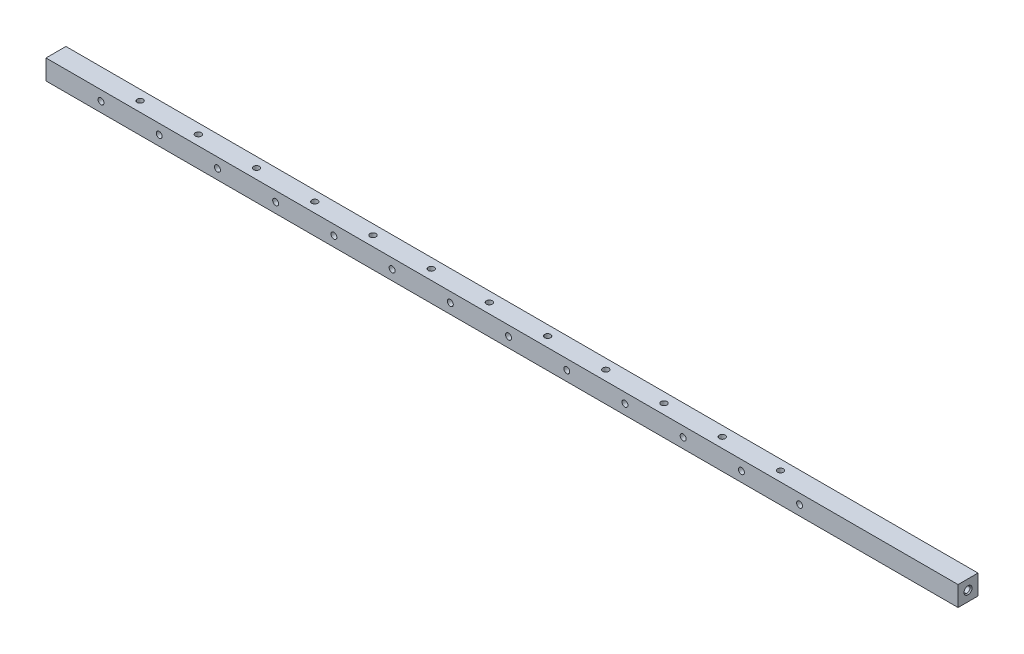
from build123d import *

# Parameters (mm, degrees)
SKETCH1_W                        = 12.7
SKETCH1_H                        = 12.7
BOSS_EXTRUDE1_DEPTH              = 581
F_10_24_TAPPED_HOLE1_D           = 3.7973
F_10_24_TAPPED_HOLE2_D           = 3.7973
M6X1_0_TAPPED_HOLE2_D            = 5
M6X1_0_TAPPED_HOLE2_DEPTH        = 20.32
M6X1_0_TAPPED_HOLE2_CSINK_D      = 6.05
M6X1_0_TAPPED_HOLE2_CSINK_ANGLE  = 90
M6X1_0_TAPPED_HOLE2_TIP          = 1.502151548
F_10_24_TAPPED_HOLE3_D           = 3.7973
F_10_24_TAPPED_HOLE3_DEPTH       = 20.574
F_10_24_TAPPED_HOLE3_CSINK_D     = 5.0673
F_10_24_TAPPED_HOLE3_CSINK_ANGLE = 90
F_10_24_TAPPED_HOLE3_TIP         = 1.140824014
LPATTERN1_COUNT                  = 13
LPATTERN1_PITCH                  = 37.084
LPATTERN2_COUNT                  = 12
LPATTERN2_PITCH                  = 37.084


with BuildPart() as part:
    # Sketch1 → Boss-Extrude1 (new body)
    with BuildSketch(Plane(origin=(0, 0, 0), x_dir=(0, 0, -1), z_dir=(1, 0, 0))):
        Rectangle(SKETCH1_W, SKETCH1_H)
    extrude(amount=BOSS_EXTRUDE1_DEPTH)

    # #10-24 Tapped Hole1 (through all)
    with Locations(Plane.XY.offset(6.35)):
        with Locations((35.052, 0)):
            f_10_24_tapped_hole1 = Hole(F_10_24_TAPPED_HOLE1_D / 2)

    # #10-24 Tapped Hole2 (through all)
    with Locations(Plane(origin=(0, 6.35, 0), x_dir=(1, 0, 0), z_dir=(0, 1, 0))):
        with Locations((53.594, 0)):
            f_10_24_tapped_hole2 = Hole(F_10_24_TAPPED_HOLE2_D / 2)

    # M6x1.0 Tapped Hole2
    with Locations(Plane.ZY):
        with Locations((0, 0)):
            CounterSinkHole(M6X1_0_TAPPED_HOLE2_D / 2, M6X1_0_TAPPED_HOLE2_CSINK_D / 2, depth=M6X1_0_TAPPED_HOLE2_DEPTH, counter_sink_angle=M6X1_0_TAPPED_HOLE2_CSINK_ANGLE)
            with Locations((0, 0, -(M6X1_0_TAPPED_HOLE2_DEPTH + M6X1_0_TAPPED_HOLE2_TIP / 2))):  # 118° drill point
                Cone(0, M6X1_0_TAPPED_HOLE2_D / 2, M6X1_0_TAPPED_HOLE2_TIP, mode=Mode.SUBTRACT)

    # #10-24 Tapped Hole3
    with Locations(Plane(origin=(581, 0, 0), x_dir=(0, 0, -1), z_dir=(1, 0, 0))):
        with Locations((0, 0)):
            CounterSinkHole(F_10_24_TAPPED_HOLE3_D / 2, F_10_24_TAPPED_HOLE3_CSINK_D / 2, depth=F_10_24_TAPPED_HOLE3_DEPTH, counter_sink_angle=F_10_24_TAPPED_HOLE3_CSINK_ANGLE)
            with Locations((0, 0, -(F_10_24_TAPPED_HOLE3_DEPTH + F_10_24_TAPPED_HOLE3_TIP / 2))):  # 118° drill point
                Cone(0, F_10_24_TAPPED_HOLE3_D / 2, F_10_24_TAPPED_HOLE3_TIP, mode=Mode.SUBTRACT)

    # LPattern1: #10-24 Tapped Hole1 ×13
    with Locations(*[(i * LPATTERN1_PITCH, 0, 0) for i in range(1, LPATTERN1_COUNT)]):
        add(f_10_24_tapped_hole1, mode=Mode.SUBTRACT)

    # LPattern2: #10-24 Tapped Hole2 ×12
    with Locations(*[(i * LPATTERN2_PITCH, 0, 0) for i in range(1, LPATTERN2_COUNT)]):
        add(f_10_24_tapped_hole2, mode=Mode.SUBTRACT)


solid = part.part
